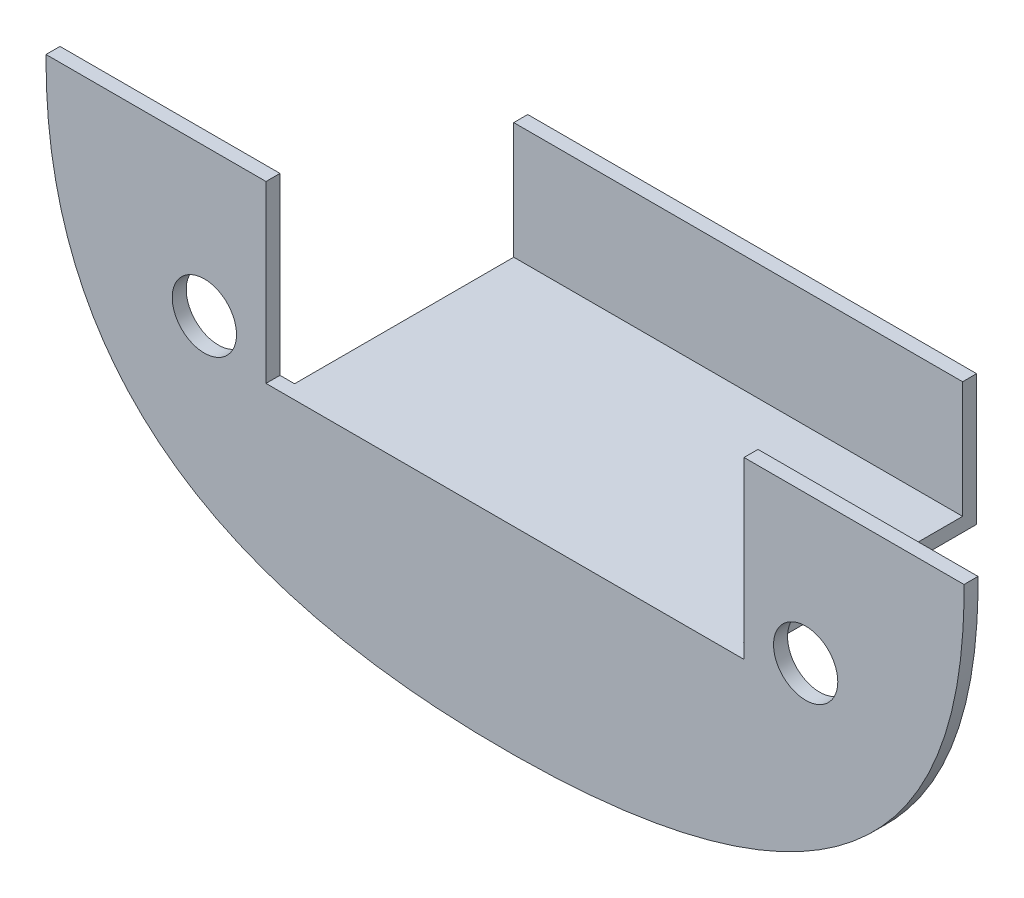
from build123d import *

# Parameters (mm, degrees)
SKETCH1_R           = 7
SKETCH1_R_2         = 7.000000001
BOSS_EXTRUDE2_DEPTH = 3.048
SKETCH2_W           = 97.79
SKETCH2_H           = 3.048
BOSS_EXTRUDE3_DEPTH = 50.8
SKETCH3_W           = 97.79
SKETCH3_H           = 3.048
BOSS_EXTRUDE4_DEPTH = 25.4


with BuildPart() as part:
    # Sketch1 → Boss-Extrude2 (new body)
    with BuildSketch(Plane(origin=(65.500000026, -188.875429159, 24.423355691), x_dir=(-1, 0, 0), z_dir=(0, 0, -1))):
        with BuildLine():
            Line((52.070000061, -36.887752409), (-52.069999939, -36.887752409))
            Line((-52.069999939, -36.887752409), (-52.069999939, 1.212247591))
            Line((-52.069999939, 1.212247591), (-100, 1.212247591))
            add(Edge.make_bspline(
                [(100, 1.212247591), (100, 0.808165429), (100, 0.404083269), (100, -3.050935364), (99.782324241, -9.153462751), (98.681398996, -18.249623033), (96.670778593, -27.192813167), (93.61774009, -35.841010629), (89.426142758, -44.003661778), (84.079370187, -51.464792157), (77.672911296, -58.036890394), (70.388362963, -63.616097827), (62.4485559, -68.199662311), (51.238518229, -73.075848655), (36.478771631, -77.121799428), (18.30840307, -79.556824322), (6.101870728, -79.999999998), (-6.101870809, -80.000000002), (-18.308403281, -79.556824309), (-36.478772031, -77.121799357), (-51.238518552, -73.075848538), (-62.448556157, -68.199662183), (-70.388363134, -63.616097708), (-77.672911394, -58.036890304), (-84.079370215, -51.464792116), (-89.426142743, -44.003661795), (-93.617740055, -35.841010707), (-96.670778559, -27.192813277), (-98.681398976, -18.249623166), (-99.782324235, -9.153462823), (-100, -3.050935434), (-100, 0.404084958), (-100, 0.808166271), (-100, 1.212247591)],
                knots=[0.441533893, 0.441533893, 0.441533893, 0.441533893, 0.443251717, 0.443251717, 0.456221785, 0.469191854, 0.482161922, 0.49513199, 0.508102059, 0.521072127, 0.534042195, 0.547012264, 0.559982332, 0.5729524, 0.598892537, 0.624832673, 0.65077281, 0.65077281, 0.676712977, 0.702653144, 0.728593312, 0.741563395, 0.754533479, 0.767503562, 0.780473646, 0.79344373, 0.806413813, 0.819383897, 0.83235398, 0.845324064, 0.858294148, 0.858294148, 0.860011969, 0.860011969, 0.860011969, 0.860011969], degree=3))
            Line((100, 1.212247591), (52.070000061, 1.212247591))
            Line((52.070000061, 1.212247591), (52.070000061, -36.887752409))
        make_face()
        with Locations((-65.5, -30.887752409)):
            Circle(SKETCH1_R, mode=Mode.SUBTRACT)
        with Locations((65.5, -30.887752409)):
            Circle(SKETCH1_R_2, mode=Mode.SUBTRACT)
    extrude(amount=BOSS_EXTRUDE2_DEPTH)

    # Sketch2 → Boss-Extrude3 (add)
    with BuildSketch(Plane(origin=(0, 0, 21.375355691), x_dir=(-1, 0, 0), z_dir=(0, 0, -1))):
        with Locations((-65.499999965, -227.287181568)):
            Rectangle(SKETCH2_W, SKETCH2_H)
    extrude(amount=BOSS_EXTRUDE3_DEPTH)

    # Sketch3 → Boss-Extrude4 (add)
    with BuildSketch(Plane(origin=(0, -225.763181568, 0), x_dir=(1, 0, 0), z_dir=(0, 1, 0))):
        with Locations((65.499999965, 27.900644309)):
            Rectangle(SKETCH3_W, SKETCH3_H)
    extrude(amount=BOSS_EXTRUDE4_DEPTH)


solid = part.part
